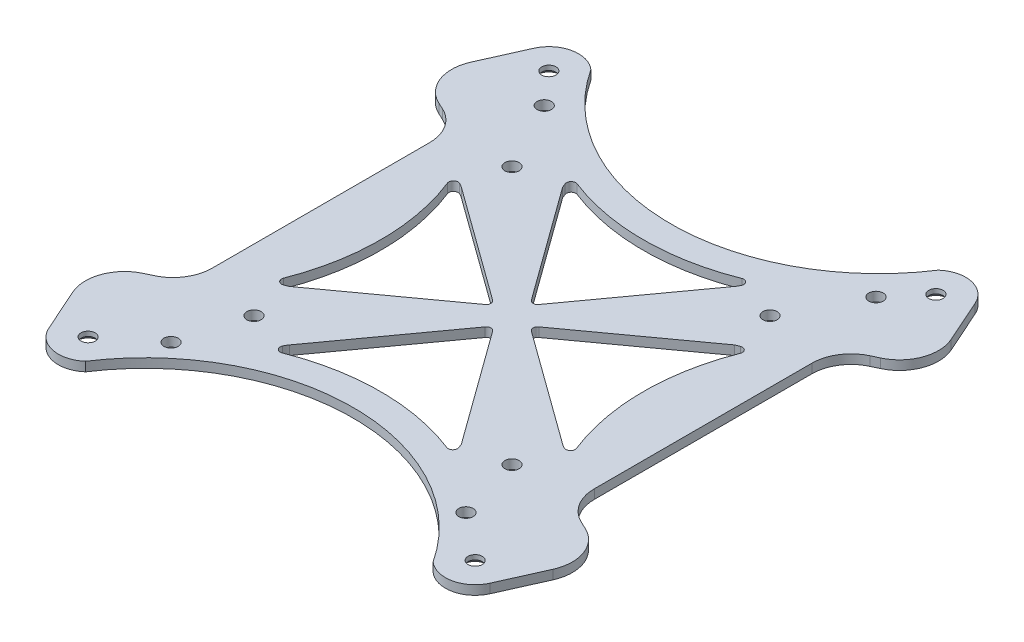
from build123d import *

# Parameters (mm, degrees)
SKETCH_1_R                  = 1.55
EXTRUDE_1_DEPTH             = 2
CHAMFER_2_SIZE              = 1
CUT_EXTRUDE_4781_DEPTH      = 111.105329369
FILLET_2_R                  = 3
FILLET_3_R                  = 5
FILLET_4_R                  = 1
SPLIT_BODIES_1_OUTLINE_R    = 1.55
SPLIT_BODIES_1_DEPTH        = 2
SPLIT_BODIES_1_2_DEPTH      = 2
SPLIT_BODIES_1_3_DEPTH      = 2
SPLIT_START                 = 0.9999999
SPLIT_BODIES_1_4_OUTLINE_R  = 1.55
SPLIT_BODIES_1_4_DEPTH      = 1.0000001
SPLIT_BODIES_1_5_DEPTH      = 0.9999999
SPLIT_BODIES_1_9_DEPTH      = 2
SPLIT_BODIES_1_10_OUTLINE_R = 1.55
SPLIT_BODIES_1_10_DEPTH     = 1.0000001
SPLIT_BODIES_1_11_DEPTH     = 0.9999999
SPLIT_BODIES_1_15_DEPTH     = 2
FILLET_5_R                  = 8.5
CUT_EXTRUDE_7856_DEPTH      = 78.358147517


with BuildPart() as part:
    # 草图1 → 凸台-拉伸1 (new body)
    with BuildSketch(Plane(origin=(0, 0, 0), x_dir=(1, 0, 0), z_dir=(0, 1, 0))):
        with BuildLine():
            Line((47.899982554, 52.633397656), (59.52497064, 26.588251477))
            Line((59.52497064, 26.588251477), (85.869588061, 26.588251477))
            Line((85.869588061, 26.588251477), (94.505759306, 0))
            Line((94.505759306, 0), (85.869588061, -26.588251477))
            Line((85.869588061, -26.588251477), (59.52497064, -26.588251477))
            Line((59.52497064, -26.588251477), (47.899982554, -52.633397656))
            ThreePointArc((47.899982554, -52.633397656), (43.362068791, -56.315801292), (37.709796983, -54.831018053))
            ThreePointArc((37.709796983, -54.831018053), (0, -36.976547041), (-37.709796983, -54.831018053))
            ThreePointArc((-37.709796983, -54.831018053), (-43.362068791, -56.315801292), (-47.899982554, -52.633397656))
            Line((-47.899982554, -52.633397656), (-59.52497064, -26.588251477))
            Line((-59.52497064, -26.588251477), (-85.869588061, -26.588251477))
            Line((-85.869588061, -26.588251477), (-94.505759306, 0))
            Line((-94.505759306, 0), (-85.869588061, 26.588251477))
            Line((-85.869588061, 26.588251477), (-59.52497064, 26.588251477))
            Line((-59.52497064, 26.588251477), (-47.899982554, 52.633397656))
            ThreePointArc((-47.899982554, 52.633397656), (-43.362068791, 56.315801292), (-37.709796983, 54.831018053))
            ThreePointArc((-37.709796983, 54.831018053), (0, 36.976547041), (37.709796983, 54.831018053))
            ThreePointArc((37.709796983, 54.831018053), (43.362068791, 56.315801292), (47.899982554, 52.633397656))
        make_face()
        with Locations(Location((42, 50, 0), (0, 0, 270))):
            Circle(SKETCH_1_R, mode=Mode.SUBTRACT)
        with Locations(Location((42, -50, 0), (0, 0, 90))):
            Circle(SKETCH_1_R, mode=Mode.SUBTRACT)
        with Locations(Location((-42, -50, 0), (0, 0, 270))):
            Circle(SKETCH_1_R, mode=Mode.SUBTRACT)
        with Locations(Location((-42, 50, 0), (0, 0, 90))):
            Circle(SKETCH_1_R, mode=Mode.SUBTRACT)
        with Locations(Location((36, 43, 0), (0, 0, 270))):
            Circle(SKETCH_1_R, mode=Mode.SUBTRACT)
        with Locations(Location((32, -42, 0), (0, 0, 270))):
            Circle(SKETCH_1_R, mode=Mode.SUBTRACT)
        with Locations(Location((-32, -42, 0), (0, 0, 90))):
            Circle(SKETCH_1_R, mode=Mode.SUBTRACT)
        with Locations(Location((-36, 43, 0), (0, 0, 90))):
            Circle(SKETCH_1_R, mode=Mode.SUBTRACT)
        with Locations(Location((70.5, 9.435839055, 0), (0, 0, 270))):
            Circle(SKETCH_1_R, mode=Mode.SUBTRACT)
        with Locations(Location((70.5, -9.435839055, 0), (0, 0, 90))):
            Circle(SKETCH_1_R, mode=Mode.SUBTRACT)
        with Locations(Location((-70.5, -9.435839055, 0), (0, 0, 270))):
            Circle(SKETCH_1_R, mode=Mode.SUBTRACT)
        with Locations(Location((-70.5, 9.435839055, 0), (0, 0, 90))):
            Circle(SKETCH_1_R, mode=Mode.SUBTRACT)
        with Locations(Location((87.3, 0, 0), (0, 0, 270))):
            Circle(SKETCH_1_R, mode=Mode.SUBTRACT)
        with Locations(Location((-87.3, 0, 0), (0, 0, 90))):
            Circle(SKETCH_1_R, mode=Mode.SUBTRACT)
        with Locations(Location((28, 28, 0), (0, 0, 270))):
            Circle(SKETCH_1_R, mode=Mode.SUBTRACT)
        with Locations(Location((28, -28, 0), (0, 0, 270))):
            Circle(SKETCH_1_R, mode=Mode.SUBTRACT)
        with Locations(Location((-28, -28, 0), (0, 0, 270))):
            Circle(SKETCH_1_R, mode=Mode.SUBTRACT)
        with Locations(Location((-28, 28, 0), (0, 0, 270))):
            Circle(SKETCH_1_R, mode=Mode.SUBTRACT)
        with BuildLine():
            Line((77.169642998, -17.5), (77.169642998, 17.5))
            ThreePointArc((77.169642998, 17.5), (79.669642998, 20), (82.169642998, 17.5))
            Line((82.169642998, 17.5), (82.169642998, -17.5))
            ThreePointArc((82.169642998, -17.5), (79.669642998, -20), (77.169642998, -17.5))
        make_face(mode=Mode.SUBTRACT)
        with BuildLine():
            Line((-77.169642998, -17.5), (-77.169642998, 17.5))
            ThreePointArc((-77.169642998, 17.5), (-79.669642998, 20), (-82.169642998, 17.5))
            Line((-82.169642998, 17.5), (-82.169642998, -17.5))
            ThreePointArc((-82.169642998, -17.5), (-79.669642998, -20), (-77.169642998, -17.5))
        make_face(mode=Mode.SUBTRACT)
        with BuildLine():
            Line((-29.630231214, 18.644740495), (-3.891240241, 0))
            Line((-3.891240241, 0), (-29.630231214, -18.644740495))
            ThreePointArc((-29.630231214, -18.644740495), (-31.15278499, -19.235170637), (-32.699643644, -19.758626516))
            ThreePointArc((-32.699643644, -19.758626516), (-28.515989447, 0), (-32.699643644, 19.758626516))
            ThreePointArc((-32.699643644, 19.758626516), (-31.086798275, 19.417002923), (-29.630231214, 18.644740495))
        make_face(mode=Mode.SUBTRACT)
        with BuildLine():
            Line((18.644740495, 29.630231214), (0, 3.891240241))
            Line((0, 3.891240241), (-18.644740495, 29.630231214))
            ThreePointArc((-18.644740495, 29.630231214), (-19.235170637, 31.15278499), (-19.758626516, 32.699643644))
            ThreePointArc((-19.758626516, 32.699643644), (0, 28.515989447), (19.758626516, 32.699643644))
            ThreePointArc((19.758626516, 32.699643644), (19.417002923, 31.086798275), (18.644740495, 29.630231214))
        make_face(mode=Mode.SUBTRACT)
        with BuildLine():
            Line((29.630231214, -18.644740495), (3.891240241, 0))
            Line((3.891240241, 0), (29.630231214, 18.644740495))
            ThreePointArc((29.630231214, 18.644740495), (31.15278499, 19.235170637), (32.699643644, 19.758626516))
            ThreePointArc((32.699643644, 19.758626516), (28.515989447, 0), (32.699643644, -19.758626516))
            ThreePointArc((32.699643644, -19.758626516), (31.086798275, -19.417002923), (29.630231214, -18.644740495))
        make_face(mode=Mode.SUBTRACT)
        with BuildLine():
            Line((-18.644740495, -29.630231214), (0, -3.891240241))
            Line((0, -3.891240241), (18.644740495, -29.630231214))
            ThreePointArc((18.644740495, -29.630231214), (19.235170637, -31.15278499), (19.758626516, -32.699643644))
            ThreePointArc((19.758626516, -32.699643644), (0, -28.515989447), (-19.758626516, -32.699643644))
            ThreePointArc((-19.758626516, -32.699643644), (-19.417002923, -31.086798275), (-18.644740495, -29.630231214))
        make_face(mode=Mode.SUBTRACT)
        with BuildLine():
            Line((41.468701347, -26.829343455), (41.468701347, 26.829343455))
            ThreePointArc((41.468701347, 26.829343455), (44.919200659, 30.279842767), (48.36969997, 26.829343455))
            Line((48.36969997, 26.829343455), (48.36969997, -26.829343455))
            ThreePointArc((48.36969997, -26.829343455), (44.919200659, -30.279842767), (41.468701347, -26.829343455))
        make_face(mode=Mode.SUBTRACT)
        with BuildLine():
            Line((-41.468701347, -26.829343455), (-41.468701347, 26.829343455))
            ThreePointArc((-41.468701347, 26.829343455), (-44.919200659, 30.279842767), (-48.36969997, 26.829343455))
            Line((-48.36969997, 26.829343455), (-48.36969997, -26.829343455))
            ThreePointArc((-48.36969997, -26.829343455), (-44.919200659, -30.279842767), (-41.468701347, -26.829343455))
        make_face(mode=Mode.SUBTRACT)
    extrude(amount=EXTRUDE_1_DEPTH)

    # 倒角2
    chamfer_2_edges = [part.edges().sort_by_distance(p)[0] for p in [
        (70.5, 0, 10.985839055),
        (-70.5, 0, 7.885839055),
        (70.5, 0, -10.985839055),
        (-70.5, 0, -7.885839055),
        (87.3, 0, -1.55),
        (-87.3, 0, 1.55),
        (-42, 0, 48.45),
        (-42, 0, -48.45),
        (42, 0, -51.55),
        (42, 0, 51.55),
    ]]
    chamfer(chamfer_2_edges, length=CHAMFER_2_SIZE)

    # Sketch 4536 → Cut-Extrude 4781 (cut, through all)
    with BuildSketch(Plane.XZ):
        Polygon((-64.75, 17.5), (-54.25, 22.965954031), (-54.25, -22.965954031), (-64.75, -17.5), align=None)
        Polygon((54.25, -22.965954031), (64.75, -17.5), (64.75, 17.5), (54.25, 22.965954031), align=None)
    extrude(amount=-CUT_EXTRUDE_4781_DEPTH, mode=Mode.SUBTRACT)

    # 圆角2
    fillet_2_edges = [part.edges().sort_by_distance(p)[0] for p in [
        (-64.75, 1, -17.5),
        (-64.75, 1, 17.5),
        (-54.25, 1, 22.965954031),
        (-54.25, 1, -22.965954031),
        (54.25, 1, -22.965954031),
        (54.25, 1, 22.965954031),
        (64.75, 1, 17.5),
        (64.75, 1, -17.5),
    ]]
    fillet(fillet_2_edges, radius=FILLET_2_R)

    # 圆角3
    fillet_3_edges = [part.edges().sort_by_distance(p)[0] for p in [
        (59.52497064, 1, -26.588251477),
        (85.869588061, 1, -26.588251477),
        (94.505759306, 1, 0),
        (85.869588061, 1, 26.588251477),
        (59.52497064, 1, 26.588251477),
        (-59.52497064, 1, 26.588251477),
        (-85.869588061, 1, 26.588251477),
        (-94.505759306, 1, 0),
        (-85.869588061, 1, -26.588251477),
        (-59.52497064, 1, -26.588251477),
    ]]
    fillet(fillet_3_edges, radius=FILLET_3_R)

    # 圆角4
    fillet_4_edges = [part.edges().sort_by_distance(p)[0] for p in [
        (-32.699643644, 1, -19.758626516),
        (-32.699643644, 1, 19.758626516),
        (-3.891240241, 1, 0),
        (32.699643644, 1, 19.758626516),
        (32.699643644, 1, -19.758626516),
        (3.891240241, 1, 0),
        (-19.758626516, 1, 32.699643644),
        (19.758626516, 1, 32.699643644),
        (0, 1, 3.891240241),
        (19.758626516, 1, -32.699643644),
        (-19.758626516, 1, -32.699643644),
        (0, 1, -3.891240241),
    ]]
    fillet(fillet_4_edges, radius=FILLET_4_R)

    # Split Bodies 1: read off the stored shape, not the designer's step
    # Split Bodies 1 outline → Split Bodies 1 (cut)
    # profile 1 of 6: a face of its own
    with BuildSketch(Plane(origin=(0, 0, 0), x_dir=(1, 0, 0), z_dir=(0, 1, 0))):
        with BuildLine():
            Line((58.202874632, 29.55033484), (55.51312302, 35.576575332))
            Line((55.51312302, 35.576575332), (43.460956659, 29.956557861))
            ThreePointArc((43.460956659, 29.956557861), (46.773152597, 29.739465052), (48.36969997, 26.829343455))
            Line((48.36969997, 26.829343455), (48.36969997, -26.829343455))
            ThreePointArc((48.36969997, -26.829343455), (46.773152542, -29.739465087), (43.46095654, -29.956557805))
            Line((43.46095654, -29.956557805), (55.513123019, -35.576575332))
            Line((55.513123019, -35.576575332), (58.202874632, -29.55033484))
            ThreePointArc((58.202874632, -29.55033484), (60.04746347, -27.393636883), (62.768714728, -26.588251477))
            Line((62.768714728, -26.588251477), (82.236501769, -26.588251477))
            ThreePointArc((82.236501769, -26.588251477), (85.175625872, -25.633192701), (86.991935468, -23.13287128))
            Line((86.991935468, -23.13287128), (94.004048949, -1.544619803))
            ThreePointArc((94.004048949, -1.544619803), (94.248615251, 0), (94.004048949, 1.544619803))
            Line((94.004048949, 1.544619803), (86.991935468, 23.13287128))
            ThreePointArc((86.991935468, 23.13287128), (85.175625872, 25.633192701), (82.236501769, 26.588251477))
            Line((82.236501769, 26.588251477), (62.768714728, 26.588251477))
            ThreePointArc((62.768714728, 26.588251477), (60.04746347, 27.393636883), (58.202874632, 29.55033484))
        make_face()
        with Locations((70.5, -9.435839055)):
            Circle(SPLIT_BODIES_1_OUTLINE_R, mode=Mode.SUBTRACT)
        with BuildLine():
            Line((54.25, -18.022107039), (54.25, 18.022107039))
            ThreePointArc((54.25, 18.022107039), (55.693680226, 20.586842651), (58.63524584, 20.683139538))
            Line((58.63524584, 20.683139538), (63.13524584, 18.340587811))
            ThreePointArc((63.13524584, 18.340587811), (64.314735612, 17.235875086), (64.75, 15.679555311))
            Line((64.75, 15.679555311), (64.75, -15.679555311))
            ThreePointArc((64.75, -15.679555311), (64.314735612, -17.235875086), (63.13524584, -18.340587811))
            Line((63.13524584, -18.340587811), (58.63524584, -20.683139538))
            ThreePointArc((58.63524584, -20.683139538), (55.693680226, -20.586842651), (54.25, -18.022107039))
        make_face(mode=Mode.SUBTRACT)
        with BuildLine():
            Line((82.169642998, 17.5), (82.169642998, -17.5))
            ThreePointArc((82.169642998, -17.5), (79.669642998, -20), (77.169642998, -17.5))
            Line((77.169642998, -17.5), (77.169642998, 17.5))
            ThreePointArc((77.169642998, 17.5), (79.669642998, 20), (82.169642998, 17.5))
        make_face(mode=Mode.SUBTRACT)
        with Locations((87.3, 0)):
            Circle(SPLIT_BODIES_1_OUTLINE_R, mode=Mode.SUBTRACT)
        with Locations((70.5, 9.435839055)):
            Circle(SPLIT_BODIES_1_OUTLINE_R, mode=Mode.SUBTRACT)
    # profile 2 of 6: a face of its own
    with BuildSketch(Plane(origin=(0, 0, 0), x_dir=(1, 0, 0), z_dir=(0, 1, 0))):
        with BuildLine():
            ThreePointArc((41.468701347, 26.829343455), (42.009079062, 28.683295394), (43.460956659, 29.956557861))
            Line((43.460956659, 29.956557861), (41.468701347, 29.027553952))
            Line((41.468701347, 29.027553952), (41.468701347, 26.829343455))
        make_face()
    # profile 3 of 6: a face of its own
    with BuildSketch(Plane(origin=(0, 0, 0), x_dir=(1, 0, 0), z_dir=(0, 1, 0))):
        with BuildLine():
            ThreePointArc((43.46095654, -29.956557805), (42.009079027, -28.683295339), (41.468701347, -26.829343455))
            Line((41.468701347, -26.829343455), (41.468701347, -29.027553952))
            Line((41.468701347, -29.027553952), (43.46095654, -29.956557805))
        make_face()
    # profile 4 of 6: a face of its own
    with BuildSketch(Plane(origin=(0, 0, 0), x_dir=(1, 0, 0), z_dir=(0, 1, 0))):
        with BuildLine():
            Line((-58.202874632, -29.55033484), (-55.51312302, -35.576575332))
            Line((-55.51312302, -35.576575332), (-43.460956659, -29.956557861))
            ThreePointArc((-43.460956659, -29.956557861), (-46.773152597, -29.739465052), (-48.36969997, -26.829343455))
            Line((-48.36969997, -26.829343455), (-48.36969997, 26.829343455))
            ThreePointArc((-48.36969997, 26.829343455), (-46.773152542, 29.739465087), (-43.46095654, 29.956557805))
            Line((-43.46095654, 29.956557805), (-55.513123019, 35.576575332))
            Line((-55.513123019, 35.576575332), (-58.202874632, 29.55033484))
            ThreePointArc((-58.202874632, 29.55033484), (-60.04746347, 27.393636883), (-62.768714728, 26.588251477))
            Line((-62.768714728, 26.588251477), (-82.236501769, 26.588251477))
            ThreePointArc((-82.236501769, 26.588251477), (-85.175625872, 25.633192701), (-86.991935468, 23.13287128))
            Line((-86.991935468, 23.13287128), (-94.004048949, 1.544619803))
            ThreePointArc((-94.004048949, 1.544619803), (-94.248615251, 0), (-94.004048949, -1.544619803))
            Line((-94.004048949, -1.544619803), (-86.991935468, -23.13287128))
            ThreePointArc((-86.991935468, -23.13287128), (-85.175625872, -25.633192701), (-82.236501769, -26.588251477))
            Line((-82.236501769, -26.588251477), (-62.768714728, -26.588251477))
            ThreePointArc((-62.768714728, -26.588251477), (-60.04746347, -27.393636883), (-58.202874632, -29.55033484))
        make_face()
        with Locations((-70.5, -9.435839055)):
            Circle(SPLIT_BODIES_1_OUTLINE_R, mode=Mode.SUBTRACT)
        with Locations((-87.3, 0)):
            Circle(SPLIT_BODIES_1_OUTLINE_R, mode=Mode.SUBTRACT)
        with BuildLine():
            Line((-77.169642998, 17.5), (-77.169642998, -17.5))
            ThreePointArc((-77.169642998, -17.5), (-79.669642998, -20), (-82.169642998, -17.5))
            Line((-82.169642998, -17.5), (-82.169642998, 17.5))
            ThreePointArc((-82.169642998, 17.5), (-79.669642998, 20), (-77.169642998, 17.5))
        make_face(mode=Mode.SUBTRACT)
        with BuildLine():
            Line((-64.75, -15.679555311), (-64.75, 15.679555311))
            ThreePointArc((-64.75, 15.679555311), (-64.314735612, 17.235875086), (-63.13524584, 18.340587811))
            Line((-63.13524584, 18.340587811), (-58.63524584, 20.683139538))
            ThreePointArc((-58.63524584, 20.683139538), (-55.693680226, 20.586842651), (-54.25, 18.022107039))
            Line((-54.25, 18.022107039), (-54.25, -18.022107039))
            ThreePointArc((-54.25, -18.022107039), (-55.693680226, -20.586842651), (-58.63524584, -20.683139538))
            Line((-58.63524584, -20.683139538), (-63.13524584, -18.340587811))
            ThreePointArc((-63.13524584, -18.340587811), (-64.314735612, -17.235875086), (-64.75, -15.679555311))
        make_face(mode=Mode.SUBTRACT)
        with Locations((-70.5, 9.435839055)):
            Circle(SPLIT_BODIES_1_OUTLINE_R, mode=Mode.SUBTRACT)
    # profile 5 of 6: a face of its own
    with BuildSketch(Plane(origin=(0, 0, 0), x_dir=(1, 0, 0), z_dir=(0, 1, 0))):
        with BuildLine():
            ThreePointArc((-41.468701347, -26.829343455), (-42.009079062, -28.683295394), (-43.460956659, -29.956557861))
            Line((-43.460956659, -29.956557861), (-41.468701347, -29.027553952))
            Line((-41.468701347, -29.027553952), (-41.468701347, -26.829343455))
        make_face()
    # profile 6 of 6: a face of its own
    with BuildSketch(Plane(origin=(0, 0, 0), x_dir=(1, 0, 0), z_dir=(0, 1, 0))):
        with BuildLine():
            ThreePointArc((-43.46095654, 29.956557805), (-42.009079027, 28.683295339), (-41.468701347, 26.829343455))
            Line((-41.468701347, 26.829343455), (-41.468701347, 29.027553952))
            Line((-41.468701347, 29.027553952), (-43.46095654, 29.956557805))
        make_face()
    extrude(amount=SPLIT_BODIES_1_DEPTH, mode=Mode.SUBTRACT)

    # 圆角5
    fillet_5_edges = [part.edges().sort_by_distance(p)[0] for p in [
        (55.51312302, 1, -35.576575332),
        (55.513123019, 1, 35.576575332),
        (-55.51312302, 1, 35.576575332),
        (-55.513123019, 1, -35.576575332),
        (41.468701347, 1, 29.027553952),
        (41.468701347, 1, -29.027553952),
        (-41.468701347, 1, -29.027553952),
        (-41.468701347, 1, 29.027553952),
    ]]
    fillet(fillet_5_edges, radius=FILLET_5_R)

    # Sketch 7715 → Cut-Extrude 7856 (cut, through all)
    with BuildSketch(Plane(origin=(0, 0, 0), x_dir=(1, 0, 0), z_dir=(0, 1, 0))):
        with BuildLine():
            ThreePointArc((37.709796983, -54.831018053), (0, -34.476547041), (-37.709796983, -54.831018053))
            ThreePointArc((-37.709796983, -54.831018053), (0, -36.976547041), (37.709796983, -54.831018053))
        make_face()
        with BuildLine():
            ThreePointArc((37.709796983, 54.831018053), (0, 36.976547041), (-37.709796983, 54.831018053))
            ThreePointArc((-37.709796983, 54.831018053), (0, 34.476547041), (37.709796983, 54.831018053))
        make_face()
    extrude(amount=CUT_EXTRUDE_7856_DEPTH, mode=Mode.SUBTRACT)


with BuildPart() as body_2:
    # Split Bodies 1 2 outline → Split Bodies 1 2 (new body)
    with BuildSketch(Plane(origin=(0, 0, 0), x_dir=(1, 0, 0), z_dir=(0, 1, 0))):
        with BuildLine():
            ThreePointArc((43.460956637, -29.956557851), (42.009079055, -28.683295384), (41.468701347, -26.829343455))
            Line((41.468701347, -26.829343455), (41.468701347, -29.027553952))
            Line((41.468701347, -29.027553952), (43.460956637, -29.956557851))
        make_face()
    extrude(amount=SPLIT_BODIES_1_2_DEPTH)


with BuildPart() as body_3:
    # Split Bodies 1 3 outline → Split Bodies 1 3 (new body)
    with BuildSketch(Plane(origin=(0, 0, 0), x_dir=(1, 0, 0), z_dir=(0, 1, 0))):
        with BuildLine():
            Line((-43.460956637, -29.956557851), (-41.468701347, -29.027553952))
            Line((-41.468701347, -29.027553952), (-41.468701347, -26.829343455))
            ThreePointArc((-41.468701347, -26.829343455), (-42.009079055, -28.683295384), (-43.460956637, -29.956557851))
        make_face()
    extrude(amount=SPLIT_BODIES_1_3_DEPTH)


with BuildPart() as body_4:
    # Split Bodies 1 4 outline → Split Bodies 1 4 (new body)
    with BuildSketch(Plane(origin=(0, 0, 0), x_dir=(1, 0, 0), z_dir=(0, 1, 0)).offset(SPLIT_START)):
        with BuildLine():
            Line((-58.202874632, -29.55033484), (-55.513123019, -35.576575332))
            Line((-55.513123019, -35.576575332), (-43.460956637, -29.956557851))
            ThreePointArc((-43.460956637, -29.956557851), (-46.773152587, -29.739465058), (-48.36969997, -26.829343455))
            Line((-48.36969997, -26.829343455), (-48.36969997, 26.829343455))
            ThreePointArc((-48.36969997, 26.829343455), (-46.773152587, 29.739465058), (-43.460956637, 29.956557851))
            Line((-43.460956637, 29.956557851), (-55.513123019, 35.576575332))
            Line((-55.513123019, 35.576575332), (-58.202874632, 29.55033484))
            ThreePointArc((-58.202874632, 29.55033484), (-60.04746347, 27.393636883), (-62.768714728, 26.588251477))
            Line((-62.768714728, 26.588251477), (-82.236501769, 26.588251477))
            ThreePointArc((-82.236501769, 26.588251477), (-85.175625872, 25.633192701), (-86.991935468, 23.13287128))
            Line((-86.991935468, 23.13287128), (-94.004048949, 1.544619803))
            ThreePointArc((-94.004048949, 1.544619803), (-94.248615251, 0), (-94.004048949, -1.544619803))
            Line((-94.004048949, -1.544619803), (-86.991935468, -23.13287128))
            ThreePointArc((-86.991935468, -23.13287128), (-85.175625872, -25.633192701), (-82.236501769, -26.588251477))
            Line((-82.236501769, -26.588251477), (-62.768714728, -26.588251477))
            ThreePointArc((-62.768714728, -26.588251477), (-60.04746347, -27.393636883), (-58.202874632, -29.55033484))
        make_face()
        with Locations((-70.5, -9.435839055)):
            Circle(SPLIT_BODIES_1_4_OUTLINE_R, mode=Mode.SUBTRACT)
        with Locations((-87.3, 0)):
            Circle(SPLIT_BODIES_1_4_OUTLINE_R, mode=Mode.SUBTRACT)
        with BuildLine():
            Line((-82.169642998, -17.5), (-82.169642998, 17.5))
            ThreePointArc((-82.169642998, 17.5), (-79.669642998, 20), (-77.169642998, 17.5))
            Line((-77.169642998, 17.5), (-77.169642998, -17.5))
            ThreePointArc((-77.169642998, -17.5), (-79.669642998, -20), (-82.169642998, -17.5))
        make_face(mode=Mode.SUBTRACT)
        with Locations((-70.5, 9.435839055)):
            Circle(SPLIT_BODIES_1_4_OUTLINE_R, mode=Mode.SUBTRACT)
        with BuildLine():
            ThreePointArc((-64.75, 15.679555311), (-64.314735612, 17.235875086), (-63.13524584, 18.340587811))
            Line((-63.13524584, 18.340587811), (-58.63524584, 20.683139538))
            ThreePointArc((-58.63524584, 20.683139538), (-55.693680226, 20.586842651), (-54.25, 18.022107039))
            Line((-54.25, 18.022107039), (-54.25, -18.022107039))
            ThreePointArc((-54.25, -18.022107039), (-55.693680226, -20.586842651), (-58.63524584, -20.683139538))
            Line((-58.63524584, -20.683139538), (-63.13524584, -18.340587811))
            ThreePointArc((-63.13524584, -18.340587811), (-64.314735612, -17.235875086), (-64.75, -15.679555311))
            Line((-64.75, -15.679555311), (-64.75, 15.679555311))
        make_face(mode=Mode.SUBTRACT)
    extrude(amount=SPLIT_BODIES_1_4_DEPTH)

    # Split Bodies 1 5 outline → Split Bodies 1 5 (add)
    with BuildSketch(Plane(origin=(0, 0, 0), x_dir=(1, 0, 0), z_dir=(0, 1, 0))):
        with BuildLine():
            Line((-58.202874632, -29.55033484), (-55.513123019, -35.576575332))
            Line((-55.513123019, -35.576575332), (-43.460956637, -29.956557851))
            ThreePointArc((-43.460956637, -29.956557851), (-46.773152587, -29.739465058), (-48.36969997, -26.829343455))
            Line((-48.36969997, -26.829343455), (-48.36969997, 26.829343455))
            ThreePointArc((-48.36969997, 26.829343455), (-46.773152587, 29.739465058), (-43.460956637, 29.956557851))
            Line((-43.460956637, 29.956557851), (-55.513123019, 35.576575332))
            Line((-55.513123019, 35.576575332), (-58.202874632, 29.55033484))
            ThreePointArc((-58.202874632, 29.55033484), (-60.04746347, 27.393636883), (-62.768714728, 26.588251477))
            Line((-62.768714728, 26.588251477), (-82.236501769, 26.588251477))
            ThreePointArc((-82.236501769, 26.588251477), (-85.175625872, 25.633192701), (-86.991935468, 23.13287128))
            Line((-86.991935468, 23.13287128), (-94.004048949, 1.544619803))
            ThreePointArc((-94.004048949, 1.544619803), (-94.248615251, 0), (-94.004048949, -1.544619803))
            Line((-94.004048949, -1.544619803), (-86.991935468, -23.13287128))
            ThreePointArc((-86.991935468, -23.13287128), (-85.175625872, -25.633192701), (-82.236501769, -26.588251477))
            Line((-82.236501769, -26.588251477), (-62.768714728, -26.588251477))
            ThreePointArc((-62.768714728, -26.588251477), (-60.04746347, -27.393636883), (-58.202874632, -29.55033484))
        make_face()
        with BuildLine():
            Line((-82.169642998, -17.5), (-82.169642998, 17.5))
            ThreePointArc((-82.169642998, 17.5), (-79.669642998, 20), (-77.169642998, 17.5))
            Line((-77.169642998, 17.5), (-77.169642998, -17.5))
            ThreePointArc((-77.169642998, -17.5), (-79.669642998, -20), (-82.169642998, -17.5))
        make_face(mode=Mode.SUBTRACT)
        with BuildLine():
            ThreePointArc((-64.75, 15.679555311), (-64.314735612, 17.235875086), (-63.13524584, 18.340587811))
            Line((-63.13524584, 18.340587811), (-58.63524584, 20.683139538))
            ThreePointArc((-58.63524584, 20.683139538), (-55.693680226, 20.586842651), (-54.25, 18.022107039))
            Line((-54.25, 18.022107039), (-54.25, -18.022107039))
            ThreePointArc((-54.25, -18.022107039), (-55.693680226, -20.586842651), (-58.63524584, -20.683139538))
            Line((-58.63524584, -20.683139538), (-63.13524584, -18.340587811))
            ThreePointArc((-63.13524584, -18.340587811), (-64.314735612, -17.235875086), (-64.75, -15.679555311))
            Line((-64.75, -15.679555311), (-64.75, 15.679555311))
        make_face(mode=Mode.SUBTRACT)
    extrude(amount=SPLIT_BODIES_1_5_DEPTH)

    # Split Bodies 1 6: loft between two sections, ruled curve by curve
    split_bodies_1_6_from = [
        Edge.make_three_point_arc((-70.5, 1, 7.885839055), (-68.95, 1, 9.435839055), (-70.5, 1, 10.985839055)),
        Edge.make_three_point_arc((-70.5, 1, 10.985839055), (-72.05, 1, 9.435839055), (-70.5, 1, 7.885839055)),
    ]
    split_bodies_1_6_to = [
        Edge.make_three_point_arc((-70.5, 0, 6.885839055), (-67.95, 0, 9.435839055), (-70.5, 0, 11.985839055)),
        Edge.make_three_point_arc((-70.5, 0, 11.985839055), (-73.05, 0, 9.435839055), (-70.5, 0, 6.885839055)),
    ]
    split_bodies_1_6 = Solid(Shell([*[Face.make_surface_from_curves(split_bodies_1_6_from[k], split_bodies_1_6_to[k]) for k in range(2)], Face(Wire(split_bodies_1_6_from)), Face(Wire(split_bodies_1_6_to))]))
    add(split_bodies_1_6, mode=Mode.SUBTRACT)

    # Split Bodies 1 7: loft between two sections, ruled curve by curve
    split_bodies_1_7_from = [
        Edge.make_three_point_arc((-70.5, 1, -10.985839055), (-68.95, 1, -9.435839055), (-70.5, 1, -7.885839055)),
        Edge.make_three_point_arc((-70.5, 1, -7.885839055), (-72.05, 1, -9.435839055), (-70.5, 1, -10.985839055)),
    ]
    split_bodies_1_7_to = [
        Edge.make_three_point_arc((-70.5, 0, -11.985839055), (-67.95, 0, -9.435839055), (-70.5, 0, -6.885839055)),
        Edge.make_three_point_arc((-70.5, 0, -6.885839055), (-73.05, 0, -9.435839055), (-70.5, 0, -11.985839055)),
    ]
    split_bodies_1_7 = Solid(Shell([*[Face.make_surface_from_curves(split_bodies_1_7_from[k], split_bodies_1_7_to[k]) for k in range(2)], Face(Wire(split_bodies_1_7_from)), Face(Wire(split_bodies_1_7_to))]))
    add(split_bodies_1_7, mode=Mode.SUBTRACT)

    # Split Bodies 1 8: loft between two sections, ruled curve by curve
    split_bodies_1_8_from = [
        Edge.make_three_point_arc((-87.3, 1, -1.55), (-85.75, 1, 0), (-87.3, 1, 1.55)),
        Edge.make_three_point_arc((-87.3, 1, 1.55), (-88.85, 1, 0), (-87.3, 1, -1.55)),
    ]
    split_bodies_1_8_to = [
        Edge.make_three_point_arc((-87.3, 0, -2.55), (-84.75, 0, 0), (-87.3, 0, 2.55)),
        Edge.make_three_point_arc((-87.3, 0, 2.55), (-89.85, 0, 0), (-87.3, 0, -2.55)),
    ]
    split_bodies_1_8 = Solid(Shell([*[Face.make_surface_from_curves(split_bodies_1_8_from[k], split_bodies_1_8_to[k]) for k in range(2)], Face(Wire(split_bodies_1_8_from)), Face(Wire(split_bodies_1_8_to))]))
    add(split_bodies_1_8, mode=Mode.SUBTRACT)


with BuildPart() as body_5:
    # Split Bodies 1 9 outline → Split Bodies 1 9 (new body)
    with BuildSketch(Plane(origin=(0, 0, 0), x_dir=(1, 0, 0), z_dir=(0, 1, 0))):
        with BuildLine():
            ThreePointArc((-43.460956637, 29.956557851), (-42.009079055, 28.683295384), (-41.468701347, 26.829343455))
            Line((-41.468701347, 26.829343455), (-41.468701347, 29.027553952))
            Line((-41.468701347, 29.027553952), (-43.460956637, 29.956557851))
        make_face()
    extrude(amount=SPLIT_BODIES_1_9_DEPTH)


with BuildPart() as body_6:
    # Split Bodies 1 10 outline → Split Bodies 1 10 (new body)
    with BuildSketch(Plane(origin=(0, 0, 0), x_dir=(1, 0, 0), z_dir=(0, 1, 0)).offset(SPLIT_START)):
        with BuildLine():
            ThreePointArc((48.36969997, -26.829343455), (46.773152587, -29.739465058), (43.460956637, -29.956557851))
            Line((43.460956637, -29.956557851), (55.513123019, -35.576575332))
            Line((55.513123019, -35.576575332), (58.202874632, -29.55033484))
            ThreePointArc((58.202874632, -29.55033484), (60.04746347, -27.393636883), (62.768714728, -26.588251477))
            Line((62.768714728, -26.588251477), (82.236501769, -26.588251477))
            ThreePointArc((82.236501769, -26.588251477), (85.175625872, -25.633192701), (86.991935468, -23.13287128))
            Line((86.991935468, -23.13287128), (94.004048949, -1.544619803))
            ThreePointArc((94.004048949, -1.544619803), (94.248615251, 0), (94.004048949, 1.544619803))
            Line((94.004048949, 1.544619803), (86.991935468, 23.13287128))
            ThreePointArc((86.991935468, 23.13287128), (85.175625872, 25.633192701), (82.236501769, 26.588251477))
            Line((82.236501769, 26.588251477), (62.768714728, 26.588251477))
            ThreePointArc((62.768714728, 26.588251477), (60.04746347, 27.393636883), (58.202874632, 29.55033484))
            Line((58.202874632, 29.55033484), (55.513123019, 35.576575332))
            Line((55.513123019, 35.576575332), (43.460956637, 29.956557851))
            ThreePointArc((43.460956637, 29.956557851), (46.773152587, 29.739465058), (48.36969997, 26.829343455))
            Line((48.36969997, 26.829343455), (48.36969997, -26.829343455))
        make_face()
        with Locations((70.5, -9.435839055)):
            Circle(SPLIT_BODIES_1_10_OUTLINE_R, mode=Mode.SUBTRACT)
        with BuildLine():
            Line((54.25, -18.022107039), (54.25, 18.022107039))
            ThreePointArc((54.25, 18.022107039), (55.693680226, 20.586842651), (58.63524584, 20.683139538))
            Line((58.63524584, 20.683139538), (63.13524584, 18.340587811))
            ThreePointArc((63.13524584, 18.340587811), (64.314735612, 17.235875086), (64.75, 15.679555311))
            Line((64.75, 15.679555311), (64.75, -15.679555311))
            ThreePointArc((64.75, -15.679555311), (64.314735612, -17.235875086), (63.13524584, -18.340587811))
            Line((63.13524584, -18.340587811), (58.63524584, -20.683139538))
            ThreePointArc((58.63524584, -20.683139538), (55.693680226, -20.586842651), (54.25, -18.022107039))
        make_face(mode=Mode.SUBTRACT)
        with BuildLine():
            Line((82.169642998, 17.5), (82.169642998, -17.5))
            ThreePointArc((82.169642998, -17.5), (79.669642998, -20), (77.169642998, -17.5))
            Line((77.169642998, -17.5), (77.169642998, 17.5))
            ThreePointArc((77.169642998, 17.5), (79.669642998, 20), (82.169642998, 17.5))
        make_face(mode=Mode.SUBTRACT)
        with Locations((70.5, 9.435839055)):
            Circle(SPLIT_BODIES_1_10_OUTLINE_R, mode=Mode.SUBTRACT)
        with Locations((87.3, 0)):
            Circle(SPLIT_BODIES_1_10_OUTLINE_R, mode=Mode.SUBTRACT)
    extrude(amount=SPLIT_BODIES_1_10_DEPTH)

    # Split Bodies 1 11 outline → Split Bodies 1 11 (add)
    with BuildSketch(Plane(origin=(0, 0, 0), x_dir=(1, 0, 0), z_dir=(0, 1, 0))):
        with BuildLine():
            ThreePointArc((48.36969997, -26.829343455), (46.773152587, -29.739465058), (43.460956637, -29.956557851))
            Line((43.460956637, -29.956557851), (55.513123019, -35.576575332))
            Line((55.513123019, -35.576575332), (58.202874632, -29.55033484))
            ThreePointArc((58.202874632, -29.55033484), (60.04746347, -27.393636883), (62.768714728, -26.588251477))
            Line((62.768714728, -26.588251477), (82.236501769, -26.588251477))
            ThreePointArc((82.236501769, -26.588251477), (85.175625872, -25.633192701), (86.991935468, -23.13287128))
            Line((86.991935468, -23.13287128), (94.004048949, -1.544619803))
            ThreePointArc((94.004048949, -1.544619803), (94.248615251, 0), (94.004048949, 1.544619803))
            Line((94.004048949, 1.544619803), (86.991935468, 23.13287128))
            ThreePointArc((86.991935468, 23.13287128), (85.175625872, 25.633192701), (82.236501769, 26.588251477))
            Line((82.236501769, 26.588251477), (62.768714728, 26.588251477))
            ThreePointArc((62.768714728, 26.588251477), (60.04746347, 27.393636883), (58.202874632, 29.55033484))
            Line((58.202874632, 29.55033484), (55.513123019, 35.576575332))
            Line((55.513123019, 35.576575332), (43.460956637, 29.956557851))
            ThreePointArc((43.460956637, 29.956557851), (46.773152587, 29.739465058), (48.36969997, 26.829343455))
            Line((48.36969997, 26.829343455), (48.36969997, -26.829343455))
        make_face()
        with BuildLine():
            Line((54.25, -18.022107039), (54.25, 18.022107039))
            ThreePointArc((54.25, 18.022107039), (55.693680226, 20.586842651), (58.63524584, 20.683139538))
            Line((58.63524584, 20.683139538), (63.13524584, 18.340587811))
            ThreePointArc((63.13524584, 18.340587811), (64.314735612, 17.235875086), (64.75, 15.679555311))
            Line((64.75, 15.679555311), (64.75, -15.679555311))
            ThreePointArc((64.75, -15.679555311), (64.314735612, -17.235875086), (63.13524584, -18.340587811))
            Line((63.13524584, -18.340587811), (58.63524584, -20.683139538))
            ThreePointArc((58.63524584, -20.683139538), (55.693680226, -20.586842651), (54.25, -18.022107039))
        make_face(mode=Mode.SUBTRACT)
        with BuildLine():
            Line((82.169642998, 17.5), (82.169642998, -17.5))
            ThreePointArc((82.169642998, -17.5), (79.669642998, -20), (77.169642998, -17.5))
            Line((77.169642998, -17.5), (77.169642998, 17.5))
            ThreePointArc((77.169642998, 17.5), (79.669642998, 20), (82.169642998, 17.5))
        make_face(mode=Mode.SUBTRACT)
    extrude(amount=SPLIT_BODIES_1_11_DEPTH)

    # Split Bodies 1 12: loft between two sections, ruled curve by curve
    split_bodies_1_12_from = [
        Edge.make_three_point_arc((70.5, 1, 7.885839055), (72.05, 1, 9.435839055), (70.5, 1, 10.985839055)),
        Edge.make_three_point_arc((70.5, 1, 10.985839055), (68.95, 1, 9.435839055), (70.5, 1, 7.885839055)),
    ]
    split_bodies_1_12_to = [
        Edge.make_three_point_arc((70.5, 0, 6.885839055), (73.05, 0, 9.435839055), (70.5, 0, 11.985839055)),
        Edge.make_three_point_arc((70.5, 0, 11.985839055), (67.95, 0, 9.435839055), (70.5, 0, 6.885839055)),
    ]
    split_bodies_1_12 = Solid(Shell([*[Face.make_surface_from_curves(split_bodies_1_12_from[k], split_bodies_1_12_to[k]) for k in range(2)], Face(Wire(split_bodies_1_12_from)), Face(Wire(split_bodies_1_12_to))]))
    add(split_bodies_1_12, mode=Mode.SUBTRACT)

    # Split Bodies 1 13: loft between two sections, ruled curve by curve
    split_bodies_1_13_from = [
        Edge.make_three_point_arc((70.5, 1, -10.985839055), (72.05, 1, -9.435839055), (70.5, 1, -7.885839055)),
        Edge.make_three_point_arc((70.5, 1, -7.885839055), (68.95, 1, -9.435839055), (70.5, 1, -10.985839055)),
    ]
    split_bodies_1_13_to = [
        Edge.make_three_point_arc((70.5, 0, -11.985839055), (73.05, 0, -9.435839055), (70.5, 0, -6.885839055)),
        Edge.make_three_point_arc((70.5, 0, -6.885839055), (67.95, 0, -9.435839055), (70.5, 0, -11.985839055)),
    ]
    split_bodies_1_13 = Solid(Shell([*[Face.make_surface_from_curves(split_bodies_1_13_from[k], split_bodies_1_13_to[k]) for k in range(2)], Face(Wire(split_bodies_1_13_from)), Face(Wire(split_bodies_1_13_to))]))
    add(split_bodies_1_13, mode=Mode.SUBTRACT)

    # Split Bodies 1 14: loft between two sections, ruled curve by curve
    split_bodies_1_14_from = [
        Edge.make_three_point_arc((87.3, 1, -1.55), (88.85, 1, 0), (87.3, 1, 1.55)),
        Edge.make_three_point_arc((87.3, 1, 1.55), (85.75, 1, 0), (87.3, 1, -1.55)),
    ]
    split_bodies_1_14_to = [
        Edge.make_three_point_arc((87.3, 0, -2.55), (89.85, 0, 0), (87.3, 0, 2.55)),
        Edge.make_three_point_arc((87.3, 0, 2.55), (84.75, 0, 0), (87.3, 0, -2.55)),
    ]
    split_bodies_1_14 = Solid(Shell([*[Face.make_surface_from_curves(split_bodies_1_14_from[k], split_bodies_1_14_to[k]) for k in range(2)], Face(Wire(split_bodies_1_14_from)), Face(Wire(split_bodies_1_14_to))]))
    add(split_bodies_1_14, mode=Mode.SUBTRACT)


with BuildPart() as body_7:
    # Split Bodies 1 15 outline → Split Bodies 1 15 (new body)
    with BuildSketch(Plane(origin=(0, 0, 0), x_dir=(1, 0, 0), z_dir=(0, 1, 0))):
        with BuildLine():
            Line((43.460956637, 29.956557851), (41.468701347, 29.027553952))
            Line((41.468701347, 29.027553952), (41.468701347, 26.829343455))
            ThreePointArc((41.468701347, 26.829343455), (42.009079055, 28.683295384), (43.460956637, 29.956557851))
        make_face()
    extrude(amount=SPLIT_BODIES_1_15_DEPTH)


solid = part.part
